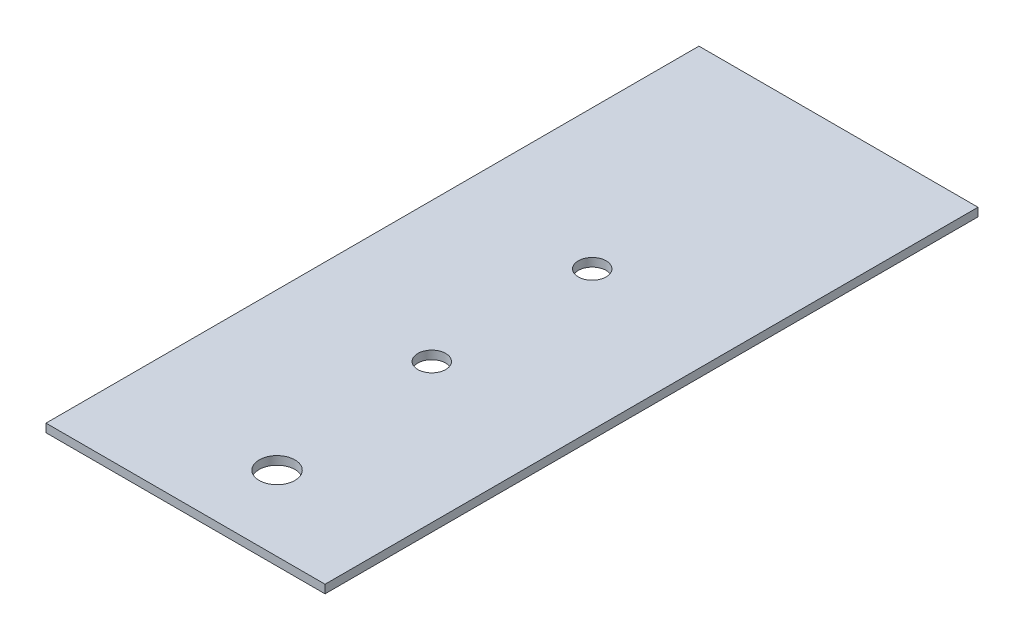
from build123d import *

# Parameters (mm, degrees)
SKETCH1_W           = 63.5
SKETCH1_H           = 148.59
BOSS_EXTRUDE1_DEPTH = 1.905
SKETCH2_R           = 4.064
SKETCH2_R_2         = 3.175
CUT_EXTRUDE1_DEPTH  = 2.54


with BuildPart() as part:
    # Sketch1 → Boss-Extrude1 (new body)
    with BuildSketch(Plane(origin=(0, 0, 0), x_dir=(1, 0, 0), z_dir=(0, 1, 0))):
        with Locations((31.75, 74.295)):
            Rectangle(SKETCH1_W, SKETCH1_H)
    extrude(amount=BOSS_EXTRUDE1_DEPTH)

    # Sketch2 → Cut-Extrude1 (cut)
    with BuildSketch(Plane(origin=(0, 1.905, 0), x_dir=(1, 0, 0), z_dir=(0, 1, 0))):
        with Locations((35.56, 17.018)):
            Circle(SKETCH2_R)
        with Locations((31.75, 56.03875)):
            Circle(SKETCH2_R_2)
        with Locations((31.75, 92.55125)):
            Circle(SKETCH2_R_2)
    extrude(amount=-CUT_EXTRUDE1_DEPTH, mode=Mode.SUBTRACT)


solid = part.part
